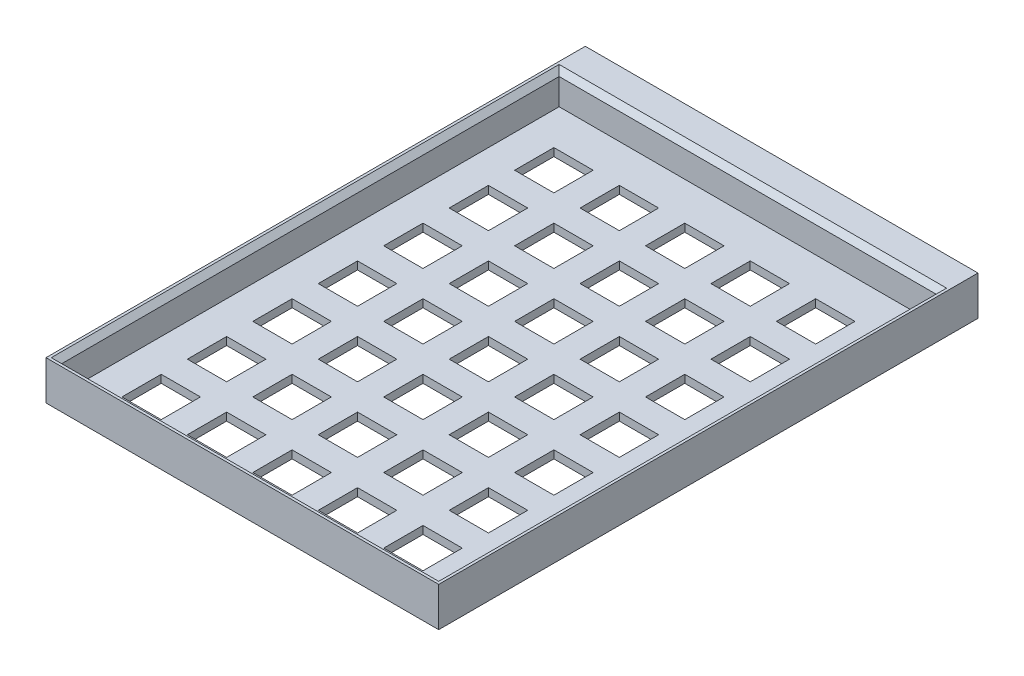
from build123d import *

# Parameters (mm, degrees)
SKETCH1_W           = 150
SKETCH1_H           = 15
BOSS_EXTRUDE1_DEPTH = 206
SKETCH2_W           = 144
SKETCH2_H           = 190
CUT_EXTRUDE1_DEPTH  = 12
SKETCH1_3_W         = 50
SKETCH1_3_H         = 8
CUT_EXTRUDE3_DEPTH  = 6
SKETCH3_W           = 30
SKETCH3_H           = 4
CUT_EXTRUDE4_DEPTH  = 2
CHAMFER1_SIZE2      = 3.464101615
CHAMFER1_SIZE       = 6
CHAMFER2_SIZE       = 2
SKETCH4_W           = 15
SKETCH4_H           = 15
CUT_EXTRUDE5_DEPTH  = 4


with BuildPart() as part:
    # Sketch1 → Boss-Extrude1 (new body)
    with BuildSketch(Plane.XY):
        with Locations((75, 7.5)):
            Rectangle(SKETCH1_W, SKETCH1_H)
    extrude(amount=BOSS_EXTRUDE1_DEPTH)

    # Sketch2 → Cut-Extrude1 (cut)
    with BuildSketch(Plane(origin=(0, 15, 0), x_dir=(1, 0, 0), z_dir=(0, 1, 0))):
        with Locations((75, -108)):
            Rectangle(SKETCH2_W, SKETCH2_H)
    extrude(amount=-CUT_EXTRUDE1_DEPTH, mode=Mode.SUBTRACT)

    # Sketch1<3> → Cut-Extrude3 (cut)
    with BuildSketch(Plane.XY):
        with Locations((75, 7.5)):
            Rectangle(SKETCH1_3_W, SKETCH1_3_H)
    extrude(amount=CUT_EXTRUDE3_DEPTH, mode=Mode.SUBTRACT)

    # Sketch3 → Cut-Extrude4 (cut)
    with BuildSketch(Plane(origin=(0, 3.5, 0), x_dir=(1, 0, 0), z_dir=(0, 1, 0))):
        with Locations((75, -4)):
            Rectangle(SKETCH3_W, SKETCH3_H)
    extrude(amount=-CUT_EXTRUDE4_DEPTH, mode=Mode.SUBTRACT)

    # Chamfer1
    chamfer1_edges = [part.edges().sort_by_distance(p)[0] for p in [
        (75, 11.5, 6),
    ]]
    chamfer1_side = [part.faces().sort_by_distance(p)[0] for p in [
        (75, 11.5, 5.930717968),
    ]]
    chamfer(chamfer1_edges, length=CHAMFER1_SIZE - 0.0001, length2=CHAMFER1_SIZE2 - 0.0001, reference=chamfer1_side[0])  # a hair under: the kernel refuses the full size

    # Chamfer2
    chamfer2_edges = [part.edges().sort_by_distance(p)[0] for p in [
        (147, 15, 108),
        (75, 15, 203),
        (75, 15, 13),
        (3, 15, 108),
    ]]
    chamfer(chamfer2_edges, length=CHAMFER2_SIZE)

    # Sketch4 → Cut-Extrude5 (cut)
    with BuildSketch(Plane(origin=(0, 3, 0), x_dir=(1, 0, 0), z_dir=(0, 1, 0))):
        with Locations((23, -35)):
            Rectangle(SKETCH4_W, SKETCH4_H)
        with Locations((48, -35)):
            Rectangle(SKETCH4_W, SKETCH4_H)
        with Locations((73, -35)):
            Rectangle(SKETCH4_W, SKETCH4_H)
        with Locations((98, -35)):
            Rectangle(SKETCH4_W, SKETCH4_H)
        with Locations((123, -35)):
            Rectangle(SKETCH4_W, SKETCH4_H)
        with Locations((48, -60)):
            Rectangle(SKETCH4_W, SKETCH4_H)
        with Locations((73, -60)):
            Rectangle(SKETCH4_W, SKETCH4_H)
        with Locations((98, -60)):
            Rectangle(SKETCH4_W, SKETCH4_H)
        with Locations((123, -60)):
            Rectangle(SKETCH4_W, SKETCH4_H)
        with Locations((48, -85)):
            Rectangle(SKETCH4_W, SKETCH4_H)
        with Locations((73, -85)):
            Rectangle(SKETCH4_W, SKETCH4_H)
        with Locations((98, -85)):
            Rectangle(SKETCH4_W, SKETCH4_H)
        with Locations((123, -85)):
            Rectangle(SKETCH4_W, SKETCH4_H)
        with Locations((48, -110)):
            Rectangle(SKETCH4_W, SKETCH4_H)
        with Locations((73, -110)):
            Rectangle(SKETCH4_W, SKETCH4_H)
        with Locations((98, -110)):
            Rectangle(SKETCH4_W, SKETCH4_H)
        with Locations((123, -110)):
            Rectangle(SKETCH4_W, SKETCH4_H)
        with Locations((48, -135)):
            Rectangle(SKETCH4_W, SKETCH4_H)
        with Locations((73, -135)):
            Rectangle(SKETCH4_W, SKETCH4_H)
        with Locations((98, -135)):
            Rectangle(SKETCH4_W, SKETCH4_H)
        with Locations((123, -135)):
            Rectangle(SKETCH4_W, SKETCH4_H)
        with Locations((48, -160)):
            Rectangle(SKETCH4_W, SKETCH4_H)
        with Locations((73, -160)):
            Rectangle(SKETCH4_W, SKETCH4_H)
        with Locations((98, -160)):
            Rectangle(SKETCH4_W, SKETCH4_H)
        with Locations((123, -160)):
            Rectangle(SKETCH4_W, SKETCH4_H)
        with Locations((48, -185)):
            Rectangle(SKETCH4_W, SKETCH4_H)
        with Locations((73, -185)):
            Rectangle(SKETCH4_W, SKETCH4_H)
        with Locations((98, -185)):
            Rectangle(SKETCH4_W, SKETCH4_H)
        with Locations((123, -185)):
            Rectangle(SKETCH4_W, SKETCH4_H)
        with Locations((23, -60)):
            Rectangle(SKETCH4_W, SKETCH4_H)
        with Locations((23, -85)):
            Rectangle(SKETCH4_W, SKETCH4_H)
        with Locations((23, -110)):
            Rectangle(SKETCH4_W, SKETCH4_H)
        with Locations((23, -135)):
            Rectangle(SKETCH4_W, SKETCH4_H)
        with Locations((23, -160)):
            Rectangle(SKETCH4_W, SKETCH4_H)
        with Locations((23, -185)):
            Rectangle(SKETCH4_W, SKETCH4_H)
    extrude(amount=-CUT_EXTRUDE5_DEPTH, mode=Mode.SUBTRACT)


solid = part.part
